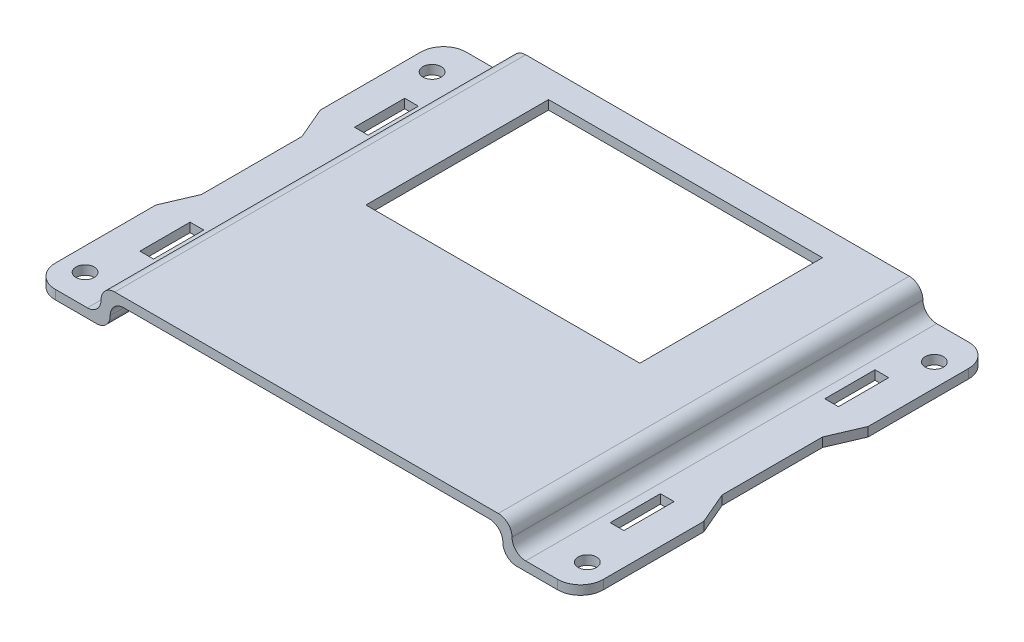
from build123d import *

# Parameters (mm, degrees)
EXTRUDE_1_DEPTH     = 90
SKETCH_2_W          = 3
SKETCH_2_H          = 11
SKETCH_2_W_2        = 60
SKETCH_2_H_2        = 40
CUT_EXTRUDE_1_DEPTH = 109.461974904
CUT_EXTRUDE_2_REACH = 110.462
SKETCH_3_R          = 2
FILLET_1_R          = 5
FILLET_2_DEPTH      = 90
FILLET_2_2_DEPTH    = 90
CUT_EXTRUDE_3_REACH = 110.333


with BuildPart() as part:
    # 草图1 → 凸台-拉伸1 (new body)
    with BuildSketch(Plane.XY):
        Polygon((-43, 0), (43, 0), (43, -6), (60, -6), (60, -4), (45, -4), (45, 2), (-45, 2), (-45, -4), (-60, -4), (-60, -6), (-43, -6), align=None)
    extrude(amount=EXTRUDE_1_DEPTH)

    # 草图2 → 切除-拉伸1 (cut, through all)
    with BuildSketch(Plane(origin=(0, 2, 0), x_dir=(1, 0, 0), z_dir=(0, 1, 0))):
        with Locations((51.5, -21)):
            Rectangle(SKETCH_2_W, SKETCH_2_H)
        with Locations((51.5, -68)):
            Rectangle(SKETCH_2_W, SKETCH_2_H)
        with Locations((-51.5, -21)):
            Rectangle(SKETCH_2_W, SKETCH_2_H)
        with Locations((-51.5, -68)):
            Rectangle(SKETCH_2_W, SKETCH_2_H)
        with Locations((-1, -26)):
            Rectangle(SKETCH_2_W_2, SKETCH_2_H_2)
    extrude(amount=-CUT_EXTRUDE_1_DEPTH, mode=Mode.SUBTRACT)

    # 草图3 → 切除-拉伸2 (cut, up to next)
    with BuildSketch(Plane.XZ.offset(6), mode=Mode.PRIVATE) as cut_extrude_2_sk1:
        with Locations((55, 7.5)):
            Circle(SKETCH_3_R)
    cut_extrude_2_tool1 = extrude(cut_extrude_2_sk1.sketch, amount=-CUT_EXTRUDE_2_REACH, mode=Mode.PRIVATE) & part.part
    # 草图3 → 切除-拉伸2 (cut, up to next)
    with BuildSketch(Plane.XZ.offset(6), mode=Mode.PRIVATE) as cut_extrude_2_sk2:
        with Locations((55, 83.5)):
            Circle(SKETCH_3_R)
    cut_extrude_2_tool2 = extrude(cut_extrude_2_sk2.sketch, amount=-CUT_EXTRUDE_2_REACH, mode=Mode.PRIVATE) & part.part
    # 草图3 → 切除-拉伸2 (cut, up to next)
    with BuildSketch(Plane.XZ.offset(6), mode=Mode.PRIVATE) as cut_extrude_2_sk3:
        with Locations((-55, 83.5)):
            Circle(SKETCH_3_R)
    cut_extrude_2_tool3 = extrude(cut_extrude_2_sk3.sketch, amount=-CUT_EXTRUDE_2_REACH, mode=Mode.PRIVATE) & part.part
    # 草图3 → 切除-拉伸2 (cut, up to next)
    with BuildSketch(Plane.XZ.offset(6), mode=Mode.PRIVATE) as cut_extrude_2_sk4:
        with Locations((-55, 7.5)):
            Circle(SKETCH_3_R)
    cut_extrude_2_tool4 = extrude(cut_extrude_2_sk4.sketch, amount=-CUT_EXTRUDE_2_REACH, mode=Mode.PRIVATE) & part.part
    add(cut_extrude_2_tool1.solids().sort_by_distance((55, -6, 7.5))[0], mode=Mode.SUBTRACT)
    add(cut_extrude_2_tool2.solids().sort_by_distance((55, -6, 83.5))[0], mode=Mode.SUBTRACT)
    add(cut_extrude_2_tool3.solids().sort_by_distance((-55, -6, 83.5))[0], mode=Mode.SUBTRACT)
    add(cut_extrude_2_tool4.solids().sort_by_distance((-55, -6, 7.5))[0], mode=Mode.SUBTRACT)

    # 圆角1
    fillet_1_edges = [part.edges().sort_by_distance(p)[0] for p in [
        (60, -5, 0),
        (-60, -5, 0),
        (60, -5, 90),
        (-60, -5, 90),
    ]]
    fillet(fillet_1_edges, radius=FILLET_1_R)

    # 圆角2: read off the stored shape, not the designer's step
    # 圆角2 outline → 圆角2 (cut)
    with BuildSketch(Plane.XY):
        with BuildLine():
            Line((-43, -6), (-43, -3))
            ThreePointArc((-43, -3), (-43.878679656, -5.121320344), (-46, -6))
            Line((-46, -6), (-43, -6))
        make_face()
        with BuildLine():
            ThreePointArc((46, -6), (43.878679656, -5.121320344), (43, -3))
            Line((43, -3), (43, -6))
            Line((43, -6), (46, -6))
        make_face()
        with BuildLine():
            Line((45, 2), (42, 2))
            ThreePointArc((42, 2), (44.121320344, 1.121320344), (45, -1))
            Line((45, -1), (45, 2))
        make_face()
        with BuildLine():
            ThreePointArc((-45, -1), (-44.121320344, 1.121320344), (-42, 2))
            Line((-42, 2), (-45, 2))
            Line((-45, 2), (-45, -1))
        make_face()
    extrude(amount=FILLET_2_DEPTH, mode=Mode.SUBTRACT)

    # Fillet 2 2 outline → Fillet 2 2 (add)
    with BuildSketch(Plane.XY):
        with BuildLine():
            ThreePointArc((-43, -3), (-42.121320344, -0.878679656), (-40, 0))
            Line((-40, 0), (-43, 0))
            Line((-43, 0), (-43, -3))
        make_face()
        with BuildLine():
            ThreePointArc((40, 0), (42.121320344, -0.878679656), (43, -3))
            Line((43, -3), (43, 0))
            Line((43, 0), (40, 0))
        make_face()
        with BuildLine():
            Line((-45, -4), (-45, -1))
            ThreePointArc((-45, -1), (-45.878679656, -3.121320344), (-48, -4))
            Line((-48, -4), (-45, -4))
        make_face()
        with BuildLine():
            ThreePointArc((48, -4), (45.878679656, -3.121320344), (45, -1))
            Line((45, -1), (45, -4))
            Line((45, -4), (48, -4))
        make_face()
    extrude(amount=FILLET_2_2_DEPTH)

    # 草图4 → 切除-拉伸3 (cut, up to next)
    with BuildSketch(Plane(origin=(0, -4, 0), x_dir=(1, 0, 0), z_dir=(0, 1, 0)), mode=Mode.PRIVATE) as cut_extrude_3_sk1:
        Polygon((60, -27), (57, -34), (57, -56), (60, -63), align=None)
    cut_extrude_3_tool1 = extrude(cut_extrude_3_sk1.sketch, amount=-CUT_EXTRUDE_3_REACH, mode=Mode.PRIVATE) & part.part
    # 草图4 → 切除-拉伸3 (cut, up to next)
    with BuildSketch(Plane(origin=(0, -4, 0), x_dir=(1, 0, 0), z_dir=(0, 1, 0)), mode=Mode.PRIVATE) as cut_extrude_3_sk2:
        Polygon((-60, -63), (-57, -56), (-57, -34), (-60, -27), align=None)
    cut_extrude_3_tool2 = extrude(cut_extrude_3_sk2.sketch, amount=-CUT_EXTRUDE_3_REACH, mode=Mode.PRIVATE) & part.part
    add(cut_extrude_3_tool1.solids().sort_by_distance((58.62069, -4, 45))[0], mode=Mode.SUBTRACT)
    add(cut_extrude_3_tool2.solids().sort_by_distance((-58.62069, -4, 45))[0], mode=Mode.SUBTRACT)


solid = part.part
